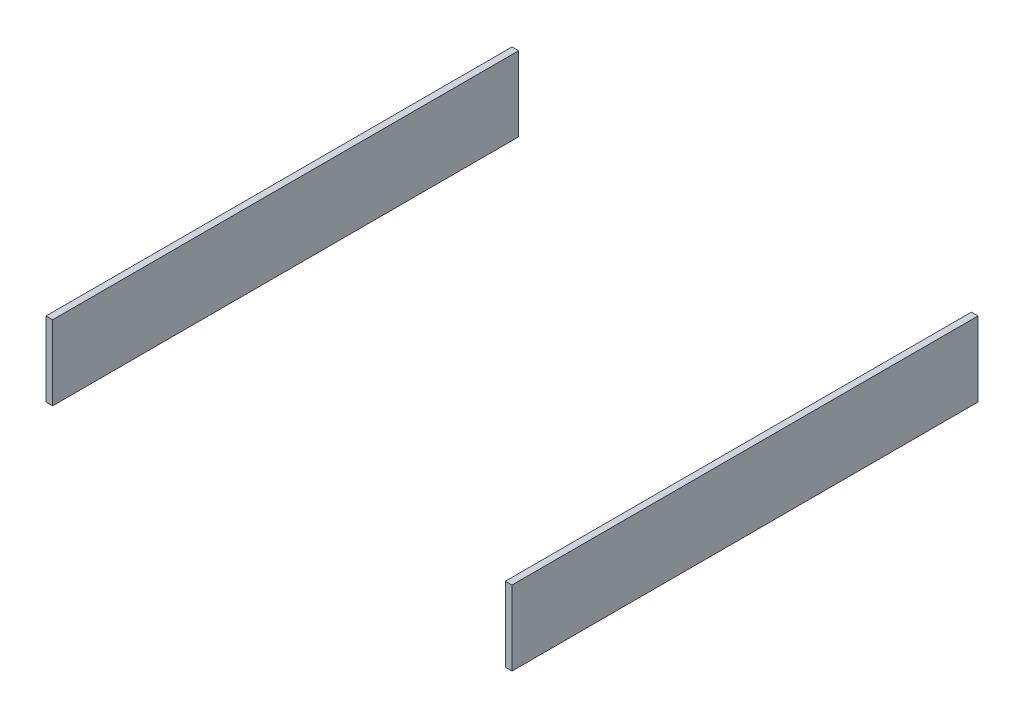
from build123d import *

# Parameters (mm, degrees)
SKETCH2_W             = 3.557003533
SKETCH2_H             = 250
BOSS_EXTRUDE2_DEPTH   = 40
BOSS_EXTRUDE2_2_DEPTH = 40


with BuildPart() as part:
    # Sketch2 → Boss-Extrude2 (new body)
    with BuildSketch(Plane(origin=(0, 1, 0), x_dir=(1, 0, 0), z_dir=(0, 1, 0))):
        with Locations((-123.221498234, 0)):
            Rectangle(SKETCH2_W, SKETCH2_H)
    extrude(amount=BOSS_EXTRUDE2_DEPTH)


with BuildPart() as body_2:
    # Sketch2 → Boss-Extrude2 2 (new body)
    with BuildSketch(Plane(origin=(0, 1, 0), x_dir=(1, 0, 0), z_dir=(0, 1, 0))):
        with Locations((123.221498234, 0)):
            Rectangle(SKETCH2_W, SKETCH2_H)
    extrude(amount=BOSS_EXTRUDE2_2_DEPTH)


solid = Compound([part.part, body_2.part])
